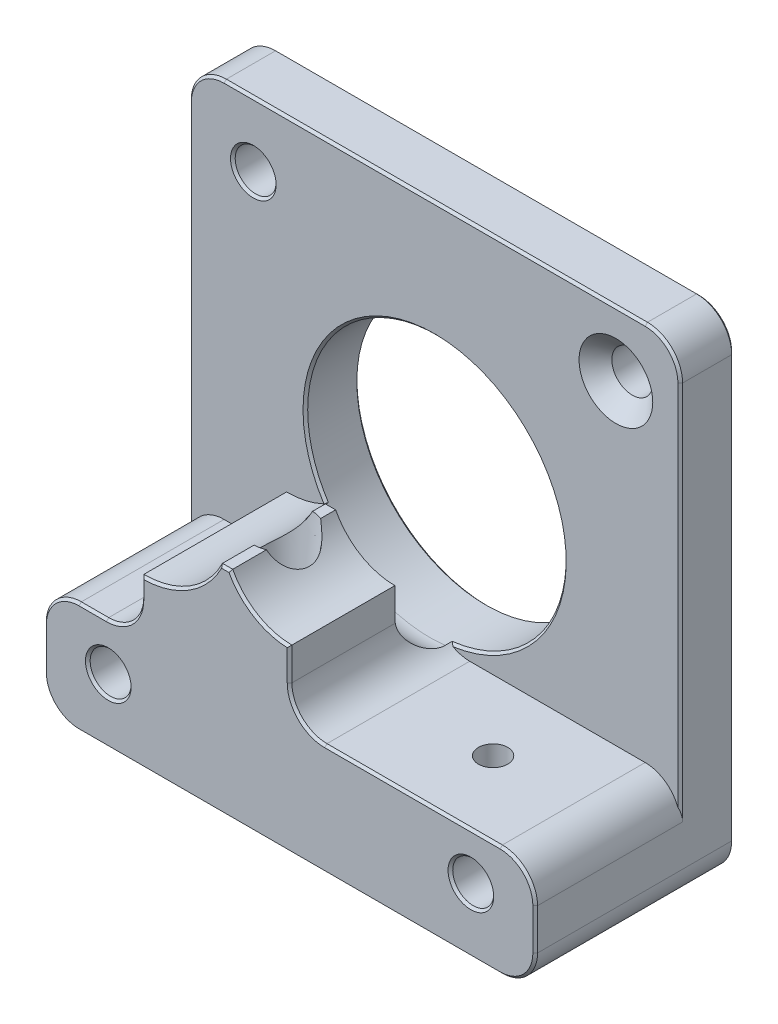
from build123d import *

# Parameters (mm, degrees)
SKETCH_1_W                                      = 42
SKETCH_1_H                                      = 42
EXTRUDE_1_DEPTH                                 = 17
CUT_EXTRUDE_1_DEPTH                             = 12.4
SKETCH_3_R                                      = 11.05
CUT_EXTRUDE_2_DEPTH                             = 8
SKETCH_5_R                                      = 1.2499999999999978
CUT_EXTRUDE_4_DEPTH                             = 12.4
FILLET_1_R                                      = 3
CHAMFER_1_SIZE                                  = 0.2
CHAMFER_2_SIZE                                  = 0.2
CHAMFER_3_SIZE                                  = 0.2
SKETCH_6_R                                      = 1.7500000000000004
SKETCH_6_R_2                                    = 1.7500000000000038
SKETCH_6_R_3                                    = 1.7499999999998814
SKETCH_6_R_4                                    = 1.7500000000000036
CUT_EXTRUDE_5_DEPTH                             = 26.00000000000001
CHAMFER_4_SIZE                                  = 0.2
FILETE2_R                                       = 3
CSK_FOR_M3_FLAT_HEAD_MACHINE_SCREW1_D           = 3.2
CSK_FOR_M3_FLAT_HEAD_MACHINE_SCREW1_CSINK_D     = 6.3
CSK_FOR_M3_FLAT_HEAD_MACHINE_SCREW1_CSINK_ANGLE = 90
TAP_DRILL_FOR_M6_TAP2_D                         = 5
TAP_DRILL_FOR_M6_TAP2_DEPTH                     = 6
TAP_DRILL_FOR_M6_TAP2_TIP                       = 1.5021515475689007


with BuildPart() as part:
    # Эскиз1 → Бобышка-Вытянуть1 (new body)
    with BuildSketch(Plane.XY):
        with Locations((21, 21)):
            Rectangle(SKETCH_1_W, SKETCH_1_H)
    extrude(amount=EXTRUDE_1_DEPTH)

    # Эскиз2 → Вырез-Вытянуть1 (cut)
    with BuildSketch(Plane.XY.offset(17)):
        with BuildLine():
            Line((0, 42), (42, 42))
            Line((42, 42), (42, 9.5))
            Line((42, 9.5), (21, 9.500000000000002))
            Line((21, 9.500000000000002), (21.00000000000009, 15.300000000000002))
            ThreePointArc((21.00000000000009, 15.300000000000002), (18.03693259362455, 16.130684694407922), (15.937505447941907, 18.380620510430074))
            Line((15.937505447941907, 18.380620510430074), (15.062505447941906, 18.380620510430074))
            ThreePointArc((15.062505447941906, 18.380620510430074), (12.29651275010685, 15.330331791538338), (8.337052317912484, 14.200000000000001))
            Line((8.337052317912484, 14.200000000000001), (8.337052317912484, 9.500000000000002))
            Line((8.337052317912484, 9.500000000000002), (3.98e-15, 9.500000000000002))
            Line((3.98e-15, 9.500000000000002), (0, 42))
        make_face()
    extrude(amount=-CUT_EXTRUDE_1_DEPTH, mode=Mode.SUBTRACT)

    # Эскиз3 → Вырез-Вытянуть2 (cut)
    with BuildSketch(Plane(origin=(0, 0, 0), x_dir=(-1, 0, 0), z_dir=(0, 0, -1))):
        with Locations((-21.000000000000007, 21.000000000000007)):
            Circle(SKETCH_3_R)
    extrude(amount=-CUT_EXTRUDE_2_DEPTH, mode=Mode.SUBTRACT)

    # Вырез-Вытянуть3 cone 1 section (through the dimple's axis) → Вырез-Вытянуть3 (revolve, cut)
    with BuildSketch(Plane(origin=(15, 18.38062051, 11.6), x_dir=(0, 0, 1), z_dir=(1, 0, 0))):
        Polygon((0, 0), (2.5, 0), (0, 20.36086607), align=None)
    revolve(axis=Axis((15, 18.38062051, 11.6), (0, -1, 0)), mode=Mode.SUBTRACT)

    # Эскиз5 → Вырез-Вытянуть4 (cut)
    with BuildSketch(Plane(origin=(0, 9.500000000000002, 0), x_dir=(1, -4e-17, 0), z_dir=(4e-17, 1, 0))):
        with Locations(Location((32.000000000000156, -10.600000000000055, 0), (0, 0, 180))):
            Circle(SKETCH_5_R)
    extrude(amount=-CUT_EXTRUDE_4_DEPTH, mode=Mode.SUBTRACT)

    # Скругление1
    # the kernel refuses this fillet: 3 mm, written as the material it adds along each edge
    with BuildSketch(Plane(origin=(21, 9.500000000000002, 17), x_dir=(1.54e-14, 1, 0), z_dir=(0, 0, -1))) as fillet_1_piece_1_section:
        with BuildLine():
            CenterArc((FILLET_1_R, FILLET_1_R), FILLET_1_R, 179.99999999999915, 90.00000000000085)
            Line((4.619e-14, FILLET_1_R), (0, 0))
            Line((0, 0), (FILLET_1_R, 0))
        make_face()
    fillet_1_piece_1 = extrude(amount=19.90000000000012, mode=Mode.PRIVATE)
    fillet_1_piece_1 = split(fillet_1_piece_1, bisect_by=Plane(origin=(21.37770329651456, 10.574866631857306, 8), z_dir=(0, 0, 1)), keep=Keep.TOP, mode=Mode.PRIVATE)
    add(fillet_1_piece_1)
    with BuildSketch(Plane(origin=(21, 9.500000000000002, 24.50000000000012), x_dir=(1.54e-14, 1, 0), z_dir=(0, 0, -1))) as fillet_1_piece_2_section:
        with BuildLine():
            CenterArc((FILLET_1_R, FILLET_1_R), FILLET_1_R, 179.99999999999915, 90.00000000000085)
            Line((4.619e-14, FILLET_1_R), (0, 0))
            Line((0, 0), (FILLET_1_R, 0))
        make_face()
    fillet_1_piece_2 = extrude(amount=19.90000000000012, mode=Mode.PRIVATE)
    fillet_1_piece_2 = fillet_1_piece_2 - Plane(origin=(21.000000000000007, 21.000000000000007, 6.3), x_dir=(-1, 0, 0), z_dir=(0, 0, -1)) * Cylinder(11.05, 52, mode=Mode.PRIVATE)
    fillet_1_piece_2 = split(fillet_1_piece_2, bisect_by=Plane(origin=(22.000979850131504, 9.712080299946667, 8), z_dir=(0, 0, -1)), keep=Keep.TOP, mode=Mode.PRIVATE)
    add(fillet_1_piece_2)
    with BuildSketch(Plane(origin=(8.337052317912484, 9.500000000000002, 17), x_dir=(-1, 0, 0), z_dir=(0, 0, -1))) as fillet_1_piece_3:
        with BuildLine():
            CenterArc((FILLET_1_R, FILLET_1_R), FILLET_1_R, 180, 90)
            Line((0, FILLET_1_R), (0, 0))
            Line((0, 0), (FILLET_1_R, 0))
        make_face()
    extrude(amount=12.4)
    # the kernel refuses this fillet: 3 mm, written as the material it takes off along each edge
    with BuildSketch(Plane(origin=(42, 42, -7.5), x_dir=(-1, 0, 0), z_dir=(0, 0, 1))) as fillet_1_2_piece_1:
        with BuildLine():
            CenterArc((FILLET_1_R, FILLET_1_R), FILLET_1_R, 180, 90)
            Line((0, FILLET_1_R), (0, 0))
            Line((0, 0), (FILLET_1_R, 0))
        make_face()
    extrude(amount=19.6, mode=Mode.SUBTRACT)
    with BuildSketch(Plane(origin=(0, 42, -7.5), x_dir=(1, 0, 0), z_dir=(0, 0, 1))) as fillet_1_2_piece_2:
        with BuildLine():
            CenterArc((FILLET_1_R, -FILLET_1_R), FILLET_1_R, 90, 90)
            Line((0, -FILLET_1_R), (0, 0))
            Line((0, 0), (FILLET_1_R, 0))
        make_face()
    extrude(amount=19.6, mode=Mode.SUBTRACT)
    with BuildSketch(Plane(origin=(42, 0, -7.5), x_dir=(-1, 0, 0), z_dir=(0, 0, 1))) as fillet_1_2_piece_3:
        with BuildLine():
            CenterArc((FILLET_1_R, -FILLET_1_R), FILLET_1_R, 90, 90)
            Line((0, -FILLET_1_R), (0, 0))
            Line((0, 0), (FILLET_1_R, 0))
        make_face()
    extrude(amount=32, mode=Mode.SUBTRACT)
    with BuildSketch(Plane(origin=(0, 0, -7.5), x_dir=(1, 0, 0), z_dir=(0, 0, 1))) as fillet_1_2_piece_4:
        with BuildLine():
            CenterArc((FILLET_1_R, FILLET_1_R), FILLET_1_R, 180, 90)
            Line((-4.4e-16, FILLET_1_R), (0, 0))
            Line((0, 0), (FILLET_1_R, 0))
        make_face()
    extrude(amount=32, mode=Mode.SUBTRACT)
    with BuildSketch(Plane(origin=(0, 9.500000000000002, 24.5), x_dir=(1, 0, 0), z_dir=(0, 0, -1))) as fillet_1_2_piece_5:
        with BuildLine():
            CenterArc((FILLET_1_R, FILLET_1_R), FILLET_1_R, 179.99999999999997, 90)
            Line((0, FILLET_1_R), (0, 0))
            Line((0, 0), (FILLET_1_R, 0))
        make_face()
    extrude(amount=19.900000000000006, mode=Mode.SUBTRACT)
    with BuildSketch(Plane(origin=(42, 9.5, 24.5), x_dir=(-1, 0, 0), z_dir=(0, 0, -1))) as fillet_1_2_piece_6:
        with BuildLine():
            CenterArc((FILLET_1_R, -FILLET_1_R), FILLET_1_R, 90, 90)
            Line((0, -FILLET_1_R), (0, 0))
            Line((0, 0), (FILLET_1_R, 0))
        make_face()
    extrude(amount=19.9, mode=Mode.SUBTRACT)

    # Фаска1
    chamfer_1_edges = [part.edges().sort_by_distance(p)[0] for p in [
        (32.05000000000001, 21.000000000000007, 0),
        (21, 42, 0),
        (0, 21, 0),
        (42, 21, 0),
        (21, 0, 0),
        (0.8786796564403576, 0.8786796564403572, 0),
        (41.121320343559645, 0.8786796564403576, 0),
        (0.8786796564403572, 41.121320343559645, 0),
        (41.121320343559645, 41.121320343559645, 0),
    ]]
    chamfer(chamfer_1_edges, length=CHAMFER_1_SIZE)

    # Фаска2
    chamfer_2_edges = [part.edges().sort_by_distance(p)[0] for p in [
        (42, 22.75, 4.6000000000000005),
        (12.296512750106848, 15.330331791538338, 17),
        (15.500005447941906, 18.380620510430074, 17),
        (18.036932593624567, 16.13068469440791, 17),
        (21.000000000000068, 13.900000000000002, 17),
        (31.500000000000014, 9.5, 17),
        (21, 42, 4.6),
        (9e-17, 22.75, 4.6000000000000005),
        (0.8786796564403572, 41.121320343559645, 4.6),
        (41.121320343559645, 41.121320343559645, 4.6),
        (8.337052317912484, 13.350000000000001, 17),
        (4.168526158956, 9.500000000000002, 17),
        (42, 4.75, 17),
        (0, 4.75, 17),
        (21, 0, 17),
        (0.8786796564403576, 8.621320343559642, 17),
        (0.8786796564403576, 0.8786796564403572, 17),
        (41.121320343559645, 8.621320343559642, 17),
        (41.121320343559645, 0.8786796564403576, 17),
        (21.878679656440376, 10.378679656440339, 17),
        (7.4583726614716435, 10.378679656440358, 17),
    ]]
    chamfer(chamfer_2_edges, length=CHAMFER_2_SIZE)

    # Фаска3
    chamfer_3_edges = [part.edges().sort_by_distance(p)[0] for p in [
        (28.33886931397383, 29.260962243734895, 4.6),
    ]]
    chamfer(chamfer_3_edges, length=CHAMFER_3_SIZE)

    # Эскиз6 → Вырез-Вытянуть5 (cut)
    with BuildSketch(Plane(origin=(0, 0, 0), x_dir=(-1, 0, 0), z_dir=(0, 0, -1))):
        with Locations((-5.50000000000014, 36.50000000000002)):
            Circle(SKETCH_6_R)
        with Locations((-36.50000000000014, 36.50000000000001)):
            Circle(SKETCH_6_R_2)
        with Locations((-5.500000000000008, 5.5000000000000115)):
            Circle(SKETCH_6_R_3)
        with Locations((-36.50000000000013, 5.500000000000008)):
            Circle(SKETCH_6_R_4)
    extrude(amount=-CUT_EXTRUDE_5_DEPTH, mode=Mode.SUBTRACT)

    # Фаска4
    chamfer_4_edges = [part.edges().sort_by_distance(p)[0] for p in [
        (7.25000000000014, 36.50000000000002, 4.6),
        (7.25000000000014, 36.50000000000002, 0),
        (38.25000000000015, 36.50000000000001, 4.6),
        (38.25000000000015, 36.50000000000001, 0),
        (7.24999999999989, 5.5000000000000115, 17),
        (7.24999999999989, 5.5000000000000115, 0),
        (38.25000000000013, 5.500000000000008, 17),
        (38.25000000000013, 5.500000000000008, 0),
    ]]
    chamfer(chamfer_4_edges, length=CHAMFER_4_SIZE)

    # Filete2
    filete2_edges = [part.edges().sort_by_distance(p)[0] for p in [
        (16.297005113109307, 11.000783075966405, 8),
    ]]
    fillet(filete2_edges, radius=FILETE2_R)

    # CSK for M3 Flat Head Machine Screw1 (through all)
    with Locations(Plane.XY.offset(4.600000000000001)):
        with Locations((36.5, 36.5)):
            CounterSinkHole(CSK_FOR_M3_FLAT_HEAD_MACHINE_SCREW1_D / 2, CSK_FOR_M3_FLAT_HEAD_MACHINE_SCREW1_CSINK_D / 2, counter_sink_angle=CSK_FOR_M3_FLAT_HEAD_MACHINE_SCREW1_CSINK_ANGLE)

    # Tap Drill for M6 Tap2
    with Locations(Plane(origin=(0, 0, 0), x_dir=(-1, 0, 0), z_dir=(0, -1, 0))):
        with Locations((-15, -11.6)):
            Hole(TAP_DRILL_FOR_M6_TAP2_D / 2, depth=TAP_DRILL_FOR_M6_TAP2_DEPTH)
            with Locations((0, 0, -(TAP_DRILL_FOR_M6_TAP2_DEPTH + TAP_DRILL_FOR_M6_TAP2_TIP / 2))):  # 118° drill point
                Cone(0, TAP_DRILL_FOR_M6_TAP2_D / 2, TAP_DRILL_FOR_M6_TAP2_TIP, mode=Mode.SUBTRACT)


solid = part.part
